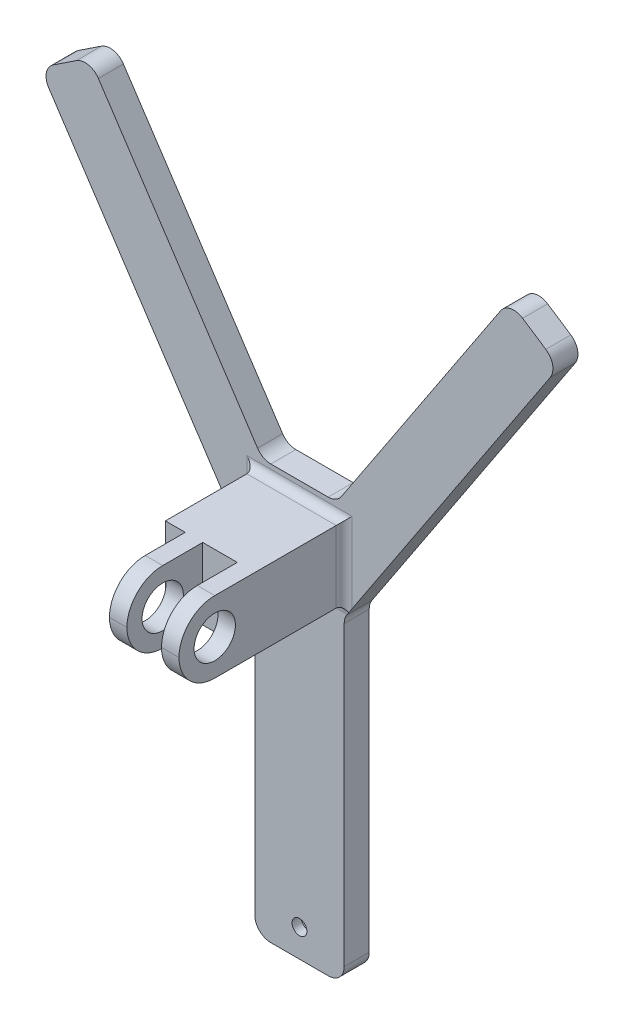
from build123d import *

# Parameters (mm, degrees)
BOSS_EXTRUDE1_DEPTH = 8
SKETCH3_W           = 28.575
SKETCH3_H           = 22.86
BOSS_EXTRUDE2_DEPTH = 52.8
FILLET1_R           = 5.08
SKETCH4_W           = 6.35
SKETCH4_H           = 24.225
SKETCH4_W_2         = 11.049
CUT_EXTRUDE1_DEPTH  = 149.293541653
FILLET3_R           = 11.43
SKETCH5_R           = 6.604
CUT_EXTRUDE2_DEPTH  = 183.273086761
SKETCH7_R           = 4.233333333
CUT_EXTRUDE3_DEPTH  = 5.08
SKETCH8_R           = 2.38125
CUT_EXTRUDE4_DEPTH  = 177.868608292
FILLET7_R           = 2.54


# Some blends are built 0.0001 mm under size
with BuildPart() as part:
    # Sketch1 → Boss-Extrude1 (new body)
    with BuildSketch(Plane.XY):
        Polygon((-11.895004803, 65.589219752), (11.895004803, 65.589219752), (67.084796123, 148.980387954), (82.970813665, 138.466732708), (14.2875, 34.687000521), (14.2875, -66.912999479), (-14.2875, -66.912999479), (-14.2875, 34.687000521), (-82.970813665, 138.466732708), (-67.084796123, 148.980387954), align=None)
    extrude(amount=BOSS_EXTRUDE1_DEPTH)

    # Sketch3 → Boss-Extrude2 (add)
    with BuildSketch(Plane.XY.offset(8)):
        with Locations((0, 50.138110136)):
            Rectangle(SKETCH3_W, SKETCH3_H)
    extrude(amount=BOSS_EXTRUDE2_DEPTH)

    # Fillet1
    fillet1_edges = [part.edges().sort_by_distance(p)[0] for p in [
        (-11.895004803, 65.589219752, 4),
        (11.895004803, 65.589219752, 4),
        (67.084796123, 148.980387954, 4),
        (82.970813665, 138.466732708, 4),
        (14.2875, 34.687000521, 4),
        (14.2875, -66.912999479, 4),
        (-14.2875, -66.912999479, 4),
        (-14.2875, 34.687000521, 4),
        (-82.970813665, 138.466732708, 4),
        (-67.084796123, 148.980387954, 4),
    ]]
    fillet(fillet1_edges, radius=FILLET1_R)

    # Sketch4 → Cut-Extrude1 (cut, through all)
    with BuildSketch(Plane.XZ.offset(-38.708110136)):
        with Locations((-11.1125, 48.6875)):
            Rectangle(SKETCH4_W, SKETCH4_H)
        with Locations((3.175, 48.6875)):
            Rectangle(SKETCH4_W_2, SKETCH4_H)
    extrude(amount=-CUT_EXTRUDE1_DEPTH, mode=Mode.SUBTRACT)

    # Fillet3
    fillet3_edges = [part.edges().sort_by_distance(p)[0] for p in [
        (11.4935, 61.568110136, 60.8),
        (-5.1435, 61.568110136, 60.8),
        (11.4935, 38.708110136, 60.8),
        (-5.1435, 38.708110136, 60.8),
    ]]
    fillet(fillet3_edges, radius=FILLET3_R - 0.0001)  # a hair under: the kernel refuses the full size

    # Sketch5 → Cut-Extrude2 (cut, through all)
    with BuildSketch(Plane.ZY.offset(7.9375)):
        with Locations(Location((49.37, 50.138110136, 0), (0, 0, 270))):
            Circle(SKETCH5_R)
    extrude(amount=-CUT_EXTRUDE2_DEPTH, mode=Mode.SUBTRACT)

    # Sketch7 → Cut-Extrude3 (cut)
    with BuildSketch(Plane(origin=(0, 0, 0), x_dir=(-1, 0, 0), z_dir=(0, 0, -1))):
        with Locations((0, -58.022999479)):
            Circle(SKETCH7_R)
    extrude(amount=-CUT_EXTRUDE3_DEPTH, mode=Mode.SUBTRACT)

    # Sketch8 → Cut-Extrude4 (cut, through all)
    with BuildSketch(Plane(origin=(0, 0, 5.08), x_dir=(-1, 0, 0), z_dir=(0, 0, -1))):
        with Locations((0, -58.022999479)):
            Circle(SKETCH8_R)
    extrude(amount=-CUT_EXTRUDE4_DEPTH, mode=Mode.SUBTRACT)

    # Fillet7
    # the kernel refuses this fillet: 2.54 mm, written as the material it adds along each edge
    with BuildSketch(Plane(origin=(-14.2875, 38.708110136, 8), x_dir=(0, 0, 1), z_dir=(0, 1, 0))) as fillet7_piece_1:
        with BuildLine():
            CenterArc((FILLET7_R, -FILLET7_R), FILLET7_R, 90, 90)
            Line((0, -FILLET7_R), (0, 0))
            Line((0, 0), (FILLET7_R, 0))
        make_face()
    extrude(amount=22.86)
    with BuildSketch(Plane(origin=(14.2875, 38.708110136, 8), x_dir=(0, 0, 1), z_dir=(-1, 0, 0))) as fillet7_piece_2:
        with BuildLine():
            CenterArc((FILLET7_R, -FILLET7_R), FILLET7_R, 90, 90)
            Line((0, -FILLET7_R), (0, 0))
            Line((0, 0), (FILLET7_R, 0))
        make_face()
    extrude(amount=28.575)
    with BuildSketch(Plane(origin=(14.2875, 61.568110136, 8), x_dir=(1, 0, 0), z_dir=(0, -1, 0))) as fillet7_piece_3:
        with BuildLine():
            CenterArc((FILLET7_R, FILLET7_R), FILLET7_R, 180, 90)
            Line((0, FILLET7_R), (0, 0))
            Line((0, 0), (FILLET7_R, 0))
        make_face()
    extrude(amount=22.86)
    with BuildSketch(Plane(origin=(-14.2875, 61.568110136, 8), x_dir=(0, 1, 0), z_dir=(1, 0, 0))) as fillet7_piece_4:
        with BuildLine():
            CenterArc((FILLET7_R, FILLET7_R), FILLET7_R, 180, 90)
            Line((0, FILLET7_R), (0, 0))
            Line((0, 0), (FILLET7_R, 0))
        make_face()
    extrude(amount=28.575)
    with BuildSketch(Plane(origin=(14.2875, 38.708110136, 8), x_dir=(0, 0, 1), z_dir=(-1, 0, 0))) as fillet7_piece_5a_section:
        with BuildLine():
            CenterArc((FILLET7_R, -FILLET7_R), FILLET7_R, 90, 90)
            Line((0, -FILLET7_R), (0, 0))
            Line((0, 0), (FILLET7_R, 0))
        make_face()
    fillet7_piece_5a = extrude(amount=34.925, mode=Mode.PRIVATE)
    fillet7_piece_5a = split(fillet7_piece_5a, bisect_by=Plane(origin=(-14.2875, 38.220078421, 8.626447049), z_dir=(-1, 0, 0)), keep=Keep.TOP, mode=Mode.PRIVATE)
    fillet7_piece_5a = split(fillet7_piece_5a, bisect_by=Plane(origin=(-16.26964909, 37.682006014, 8.626447049), z_dir=(0.833911682022307, 0.5518979131929445, 0)), keep=Keep.TOP, mode=Mode.PRIVATE)
    with BuildSketch(Plane(origin=(-14.2875, 32.358110136, 8), x_dir=(0, 0, 1), z_dir=(0, 1, 0))) as fillet7_piece_5b_section:
        with BuildLine():
            CenterArc((FILLET7_R, -FILLET7_R), FILLET7_R, 90, 90)
            Line((0, -FILLET7_R), (0, 0))
            Line((0, 0), (FILLET7_R, 0))
        make_face()
    fillet7_piece_5b = extrude(amount=29.21, mode=Mode.PRIVATE)
    fillet7_piece_5b = split(fillet7_piece_5b, bisect_by=Plane(origin=(-14.718813993, 38.708110136, 8.659953821), z_dir=(0, -1, 0)), keep=Keep.TOP, mode=Mode.PRIVATE)
    fillet7_piece_5b = split(fillet7_piece_5b, bisect_by=Plane(origin=(-15.49417016, 36.510265873, 8.659953821), z_dir=(0.833911682022307, 0.5518979131929445, 0)), keep=Keep.TOP, mode=Mode.PRIVATE)
    fillet7_piece_5 = fillet7_piece_5a & fillet7_piece_5b
    add(fillet7_piece_5)
    with BuildSketch(Plane(origin=(-14.2875, 38.708110136, 8), x_dir=(0, 0, 1), z_dir=(0, 1, 0))) as fillet7_piece_6a_section:
        with BuildLine():
            CenterArc((FILLET7_R, -FILLET7_R), FILLET7_R, 90, 90)
            Line((0, -FILLET7_R), (0, 0))
            Line((0, 0), (FILLET7_R, 0))
        make_face()
    fillet7_piece_6a = extrude(amount=29.21, mode=Mode.PRIVATE)
    fillet7_piece_6a = split(fillet7_piece_6a, bisect_by=Plane(origin=(-14.86254359, 61.568110136, 8.57504359), z_dir=(0, 1, 0)), keep=Keep.TOP, mode=Mode.PRIVATE)
    with BuildSketch(Plane(origin=(-20.6375, 61.568110136, 8), x_dir=(0, 1, 0), z_dir=(1, 0, 0))) as fillet7_piece_6b_section:
        with BuildLine():
            CenterArc((FILLET7_R, FILLET7_R), FILLET7_R, 180, 90)
            Line((0, FILLET7_R), (0, 0))
            Line((0, 0), (FILLET7_R, 0))
        make_face()
    fillet7_piece_6b = extrude(amount=34.925, mode=Mode.PRIVATE)
    fillet7_piece_6b = split(fillet7_piece_6b, bisect_by=Plane(origin=(-14.2875, 62.143153727, 8.57504359), z_dir=(-1, 0, 0)), keep=Keep.TOP, mode=Mode.PRIVATE)
    fillet7_piece_6 = fillet7_piece_6a & fillet7_piece_6b
    add(fillet7_piece_6)
    with BuildSketch(Plane(origin=(20.6375, 38.708110136, 8), x_dir=(0, 0, 1), z_dir=(-1, 0, 0))) as fillet7_piece_7a_section:
        with BuildLine():
            CenterArc((FILLET7_R, -FILLET7_R), FILLET7_R, 90, 90)
            Line((0, -FILLET7_R), (0, 0))
            Line((0, 0), (FILLET7_R, 0))
        make_face()
    fillet7_piece_7a = extrude(amount=34.925, mode=Mode.PRIVATE)
    fillet7_piece_7a = split(fillet7_piece_7a, bisect_by=Plane(origin=(14.2875, 38.220078421, 8.626447049), z_dir=(1, 0, 0)), keep=Keep.TOP, mode=Mode.PRIVATE)
    fillet7_piece_7a = split(fillet7_piece_7a, bisect_by=Plane(origin=(16.26964909, 37.682006014, 8.626447049), z_dir=(-0.8339116820223075, 0.5518979131929438, 0)), keep=Keep.TOP, mode=Mode.PRIVATE)
    with BuildSketch(Plane(origin=(14.2875, 61.568110136, 8), x_dir=(1, 0, 0), z_dir=(0, -1, 0))) as fillet7_piece_7b_section:
        with BuildLine():
            CenterArc((FILLET7_R, FILLET7_R), FILLET7_R, 180, 90)
            Line((0, FILLET7_R), (0, 0))
            Line((0, 0), (FILLET7_R, 0))
        make_face()
    fillet7_piece_7b = extrude(amount=29.21, mode=Mode.PRIVATE)
    fillet7_piece_7b = split(fillet7_piece_7b, bisect_by=Plane(origin=(14.718813993, 38.708110136, 8.659953821), z_dir=(0, -1, 0)), keep=Keep.TOP, mode=Mode.PRIVATE)
    fillet7_piece_7b = split(fillet7_piece_7b, bisect_by=Plane(origin=(15.49417016, 36.510265872, 8.659953821), z_dir=(-0.8339116820223075, 0.5518979131929438, 0)), keep=Keep.TOP, mode=Mode.PRIVATE)
    fillet7_piece_7 = fillet7_piece_7a & fillet7_piece_7b
    add(fillet7_piece_7)
    with BuildSketch(Plane(origin=(14.2875, 67.918110136, 8), x_dir=(1, 0, 0), z_dir=(0, -1, 0))) as fillet7_piece_8a_section:
        with BuildLine():
            CenterArc((FILLET7_R, FILLET7_R), FILLET7_R, 180, 90)
            Line((0, FILLET7_R), (0, 0))
            Line((0, 0), (FILLET7_R, 0))
        make_face()
    fillet7_piece_8a = extrude(amount=29.21, mode=Mode.PRIVATE)
    fillet7_piece_8a = split(fillet7_piece_8a, bisect_by=Plane(origin=(14.86254359, 61.568110136, 8.57504359), z_dir=(0, 1, 0)), keep=Keep.TOP, mode=Mode.PRIVATE)
    with BuildSketch(Plane(origin=(-14.2875, 61.568110136, 8), x_dir=(0, 1, 0), z_dir=(1, 0, 0))) as fillet7_piece_8b_section:
        with BuildLine():
            CenterArc((FILLET7_R, FILLET7_R), FILLET7_R, 180, 90)
            Line((0, FILLET7_R), (0, 0))
            Line((0, 0), (FILLET7_R, 0))
        make_face()
    fillet7_piece_8b = extrude(amount=34.925, mode=Mode.PRIVATE)
    fillet7_piece_8b = split(fillet7_piece_8b, bisect_by=Plane(origin=(14.2875, 62.143153727, 8.57504359), z_dir=(1, 0, 0)), keep=Keep.TOP, mode=Mode.PRIVATE)
    fillet7_piece_8 = fillet7_piece_8a & fillet7_piece_8b
    add(fillet7_piece_8)


solid = part.part
